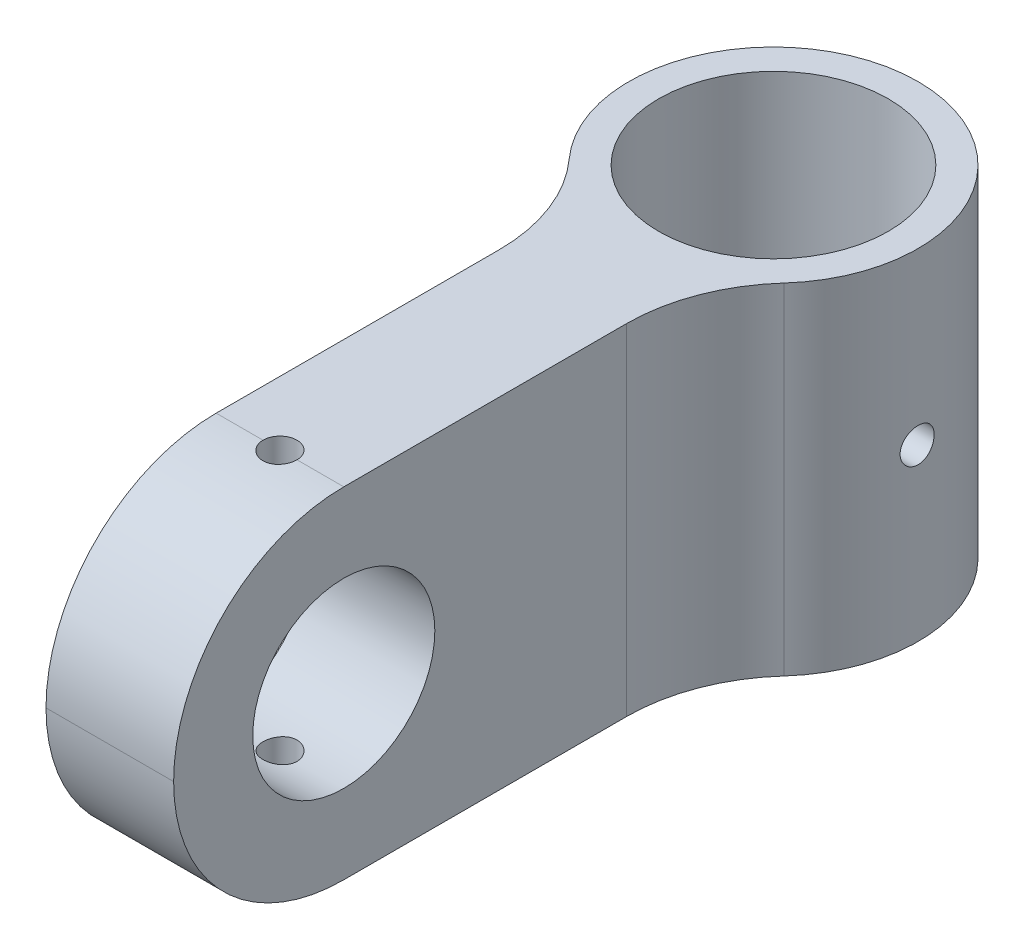
from build123d import *

# Parameters (mm, degrees)
SKETCH1_R               = 17.145
SKETCH1_R_2             = 2.54
BOSS_EXTRUDE1_DEPTH     = 25.4
CUT_EXTRUDE1_DEPTH      = 128.160236415
CUT_EXTRUDE1_DEPTH_BACK = 128.160236415
SKETCH2_R               = 13.589
SKETCH2_R_2             = 2.54
FILLET1_R               = 25.4
FILLET2_R               = 25.4


with BuildPart() as part:
    # Sketch1 → Boss-Extrude1 (new, symmetric)
    with BuildSketch(Plane(origin=(0, 0, 0), x_dir=(1, 0, 0), z_dir=(0, 1, 0))):
        with BuildLine():
            Line((-9.525, 79.684694196), (-9.525, 0))
            Line((-9.525, 0), (9.525, 0))
            Line((9.525, 0), (9.525, 79.684694196))
            ThreePointArc((9.525, 79.684694196), (0, 120.65), (-9.525, 79.684694196))
        make_face()
        with Locations(Location((0, 99.06, 0), (0, 0, 270))):
            Circle(SKETCH1_R, mode=Mode.SUBTRACT)
        with Locations(Location((0, 25.4, 0), (0, 0, 270))):
            Circle(SKETCH1_R_2, mode=Mode.SUBTRACT)
    extrude(amount=BOSS_EXTRUDE1_DEPTH, both=True)

    # Sketch2 → Cut-Extrude1 (cut, two sides: drawn at the far end of the back side and taken through both)
    with BuildSketch(Plane(origin=(9.525, 0, 0), x_dir=(0, 0, -1), z_dir=(1, 0, 0)).offset(-CUT_EXTRUDE1_DEPTH_BACK)):
        with Locations((25.4, 0)):
            Circle(SKETCH2_R)
        with Locations((99.06, 0)):
            Circle(SKETCH2_R_2)
    extrude(amount=CUT_EXTRUDE1_DEPTH + CUT_EXTRUDE1_DEPTH_BACK, mode=Mode.SUBTRACT)

    # Fillet1
    # the kernel refuses this fillet: 25.4 mm, written as the material it takes off along each edge
    with BuildSketch(Plane(origin=(-73.025, -25.4, 0), x_dir=(0, 0, -1), z_dir=(1, 0, 0)), Plane(origin=(-73.025, 25.4, 0), x_dir=(0, -1, 0), z_dir=(1, 0, 0))) as fillet1_piece_1:
        with BuildLine():
            CenterArc((FILLET1_R, FILLET1_R), FILLET1_R, 180, 90)
            Line((0, FILLET1_R), (0, 0))
            Line((0, 0), (FILLET1_R, 0))
        make_face()
    extrude(amount=146.05, mode=Mode.SUBTRACT)

    # Fillet2
    fillet2_edges = [part.edges().sort_by_distance(p)[0] for p in [
        (9.525, 0, -79.684694196),
        (-9.525, 0, -79.684694196),
    ]]
    fillet(fillet2_edges, radius=FILLET2_R)


solid = part.part
